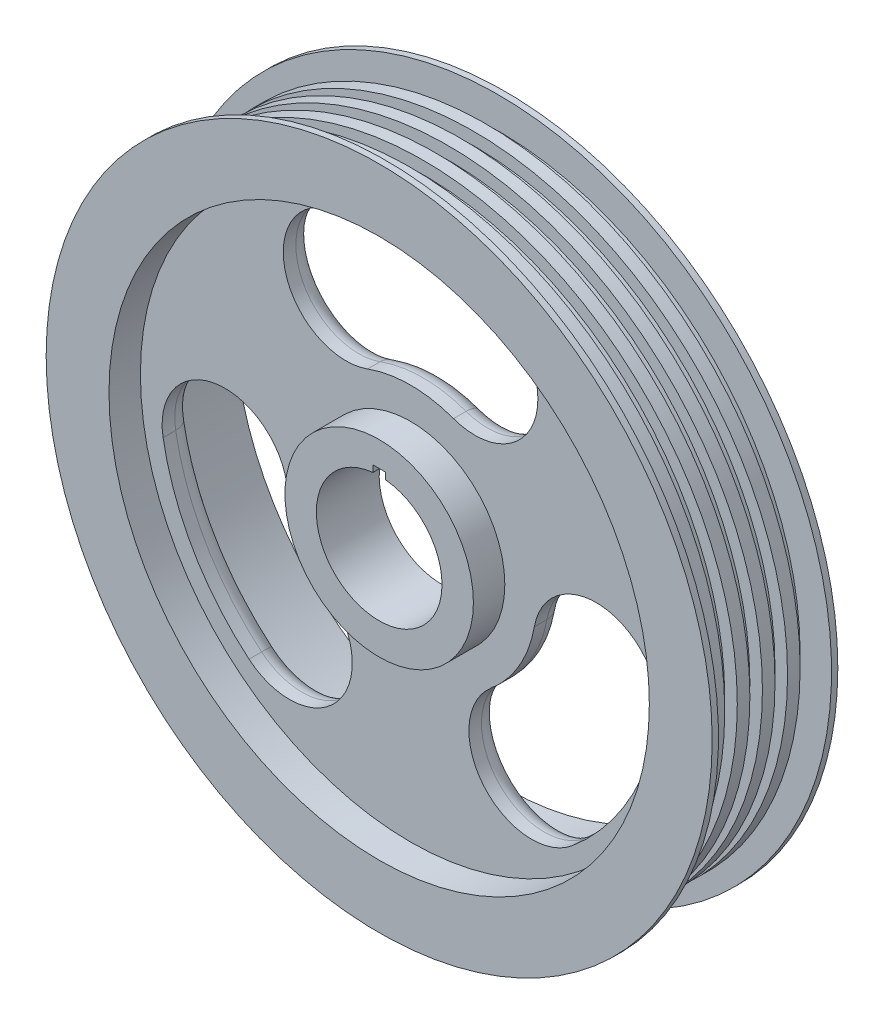
from build123d import *

# Parameters (mm, degrees)
SKETCH1_R           = 53
BOSS_EXTRUDE1_DEPTH = 20
SHELL1_T            = -10
SKETCH2_R           = 10
CUT_EXTRUDE1_DEPTH  = 20
SKETCH3_W           = 3
SKETCH3_H           = 18
SKETCH4_W           = 2
SKETCH4_H           = 2
LPATTERN1_COUNT     = 5
LPATTERN1_PITCH     = 4
SKETCH5_W           = 2
SKETCH5_H           = 3
CUT_EXTRUDE2_DEPTH  = 20
CUT_EXTRUDE3_START  = -5
SKETCH6_R           = 43
SKETCH6_R_2         = 15
CUT_EXTRUDE3_DEPTH  = 5
CUT_EXTRUDE4_DEPTH  = 5
CIRPATTERN1_COUNT   = 3
FILLET1_R           = 3


with BuildPart() as part:
    # Sketch1 → Boss-Extrude1 (new body)
    with BuildSketch(Plane.XY):
        Circle(SKETCH1_R)
    extrude(amount=BOSS_EXTRUDE1_DEPTH)

    # Shell1
    shell1_openings = [part.faces().sort_by_distance(p)[0] for p in [
        (0, 0, 0),
    ]]
    offset(amount=SHELL1_T, openings=shell1_openings, kind=Kind.INTERSECTION)

    # Sketch2 → Cut-Extrude1 (cut)
    with BuildSketch(Plane(origin=(0, 0, 10), x_dir=(-1, 0, 0), z_dir=(0, 0, -1))):
        Circle(SKETCH2_R)
    extrude(amount=-CUT_EXTRUDE1_DEPTH, mode=Mode.SUBTRACT)

    # Sketch3 → Cut-Revolve1 (revolve, cut)
    with BuildSketch(Plane(origin=(0, 0, 0), x_dir=(1, 0, 0), z_dir=(0, 1, 0)), mode=Mode.PRIVATE) as cut_revolve1_sk:
        with Locations((51.5, -10)):
            Rectangle(SKETCH3_W, SKETCH3_H)
    revolve(cut_revolve1_sk.sketch.rotate(Axis((0, 0, 0), (0, 0, 1)), 180), axis=Axis((0, 0, 0), (0, 0, 1)), mode=Mode.SUBTRACT)

    # Sketch4 → Cut-Revolve2 (revolve, cut)
    with BuildSketch(Plane(origin=(0, 0, 0), x_dir=(1, 0, 0), z_dir=(0, 1, 0)), mode=Mode.PRIVATE) as cut_revolve2_sk:
        with Locations((49, -2)):
            Rectangle(SKETCH4_W, SKETCH4_H)
    cut_revolve2 = revolve(cut_revolve2_sk.sketch.rotate(Axis((0, 0, 20), (0, 0, -1)), 180), axis=Axis((0, 0, 20), (0, 0, -1)), mode=Mode.SUBTRACT)

    # LPattern1: Cut-Revolve2 ×5
    with Locations(*[(0, 0, i * LPATTERN1_PITCH) for i in range(1, LPATTERN1_COUNT)]):
        add(cut_revolve2, mode=Mode.SUBTRACT)

    # Sketch5 → Cut-Extrude2 (cut)
    with BuildSketch(Plane(origin=(0, 0, 10), x_dir=(-1, 0, 0), z_dir=(0, 0, -1))):
        with Locations((0, 9.5)):
            Rectangle(SKETCH5_W, SKETCH5_H)
    extrude(amount=-CUT_EXTRUDE2_DEPTH, mode=Mode.SUBTRACT)

    # Sketch6 → Cut-Extrude3 (cut)
    with BuildSketch(Plane.XY.offset(20).offset(CUT_EXTRUDE3_START)):
        Circle(SKETCH6_R)
        Circle(SKETCH6_R_2, mode=Mode.SUBTRACT)
    extrude(amount=CUT_EXTRUDE3_DEPTH, mode=Mode.SUBTRACT)

    # Sketch7 → Cut-Extrude4 (cut)
    with BuildSketch(Plane(origin=(0, 0, 10), x_dir=(-1, 0, 0), z_dir=(0, 0, -1))):
        with BuildLine():
            ThreePointArc((13.680805733, 37.587704831), (0, 40), (-13.680805733, 37.587704831))
            ThreePointArc((-13.680805733, 37.587704831), (-19.657530508, 24.77057719), (-6.840402867, 18.793852416))
            ThreePointArc((-6.840402867, 18.793852416), (0, 20), (6.840402867, 18.793852416))
            ThreePointArc((6.840402867, 18.793852416), (19.657530508, 24.77057719), (13.680805733, 37.587704831))
        make_face()
    cut_extrude4 = extrude(amount=-CUT_EXTRUDE4_DEPTH, mode=Mode.SUBTRACT)

    # CirPattern1: Cut-Extrude4 ×3 about axis
    cirpattern1_axis = Axis((0, 0, 0), (0, 0, 1))
    for i in range(1, CIRPATTERN1_COUNT):
        add(cut_extrude4.rotate(cirpattern1_axis, i * 360 / CIRPATTERN1_COUNT), mode=Mode.SUBTRACT)

    # Fillet1
    fillet1_edges = [part.edges().sort_by_distance(p)[0] for p in [
        (-11.623183859, -29.40920939, 10),
        (-34.641016151, -20, 10),
        (-31.280714367, 4.6386322, 10),
        (-17.320508076, -10, 10),
        (-19.657530508, 24.77057719, 10),
        (0, 40, 10),
        (19.657530508, 24.77057719, 10),
        (0, 20, 10),
        (31.280714367, 4.6386322, 10),
        (34.641016151, -20, 10),
        (11.623183859, -29.40920939, 10),
        (17.320508076, -10, 10),
    ]]
    fillet(fillet1_edges, radius=FILLET1_R - 0.0001)  # a hair under: the kernel refuses the full size


solid = part.part
